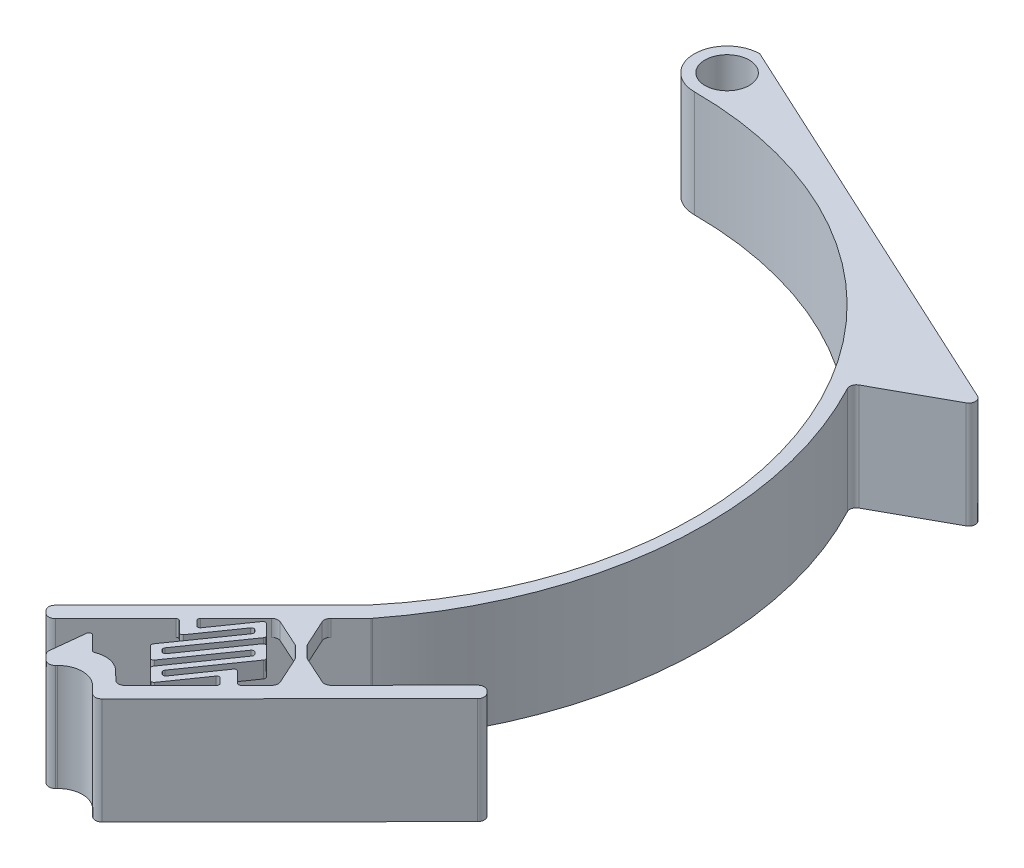
from build123d import *

# Parameters (mm, degrees)
SKETCH1_R           = 2.700000000000001
BOSS_EXTRUDE1_DEPTH = 13
SKETCH2_W           = 10
SKETCH2_H           = 9
CUT_EXTRUDE1_DEPTH  = 23
FILLET2_R           = 0.8
FILLET4_R           = 3
FILLET5_R           = 3
FILLET6_R           = 0.3
CUT_EXTRUDE2_DEPTH  = 77.54524182212118
FILLET7_R           = 0.3


with BuildPart() as part:
    # Sketch1 → Boss-Extrude1 (new body)
    with BuildSketch(Plane(origin=(0, 0, 0), x_dir=(1, 0, 0), z_dir=(0, 1, 0))):
        with BuildLine():
            Line((50.82068164403521, 29.47855622552852), (0, 52.99999999999999))
            ThreePointArc((-9.3e-16, 52.999999999999986), (-4.000000000000001, 48.999999999999986), (0, 44.999999999999986))
            ThreePointArc((0, 44.99999999999999), (40.783850416649216, 19.017821778331506), (34.47199994035405, -28.925442435894198))
            Line((34.47199994035406, -28.925442435894198), (14.701711021792928, -48.75309171856499))
            Line((14.701711021792928, -48.75309171856499), (16.117971684840867, -50.16525521274795))
            Line((16.117971684840867, -50.16525521274795), (24.237911776392924, -42.02175640022227))
            Line((24.237911776392927, -42.02175640022228), (25.457632533795294, -43.23794856854385))
            Line((25.457632533795294, -43.23794856854385), (24.004584374330847, -45.319527553848765))
            Line((24.004584374330847, -45.319527553848765), (29.270758591294335, -50.57046700111043))
            Line((29.270758591294335, -50.57046700111043), (32.75807417400898, -45.574677436378636))
            Line((32.758074174008996, -45.57467743637865), (33.79050120645283, -46.604117710803244))
            Line((33.79050120645283, -46.604117710803244), (27.435765482629456, -52.97729069451893))
            Line((27.435765482629456, -52.97729069451893), (23.895113825009613, -49.4468819590615))
            Line((23.895113825009613, -49.4468819590615), (22.48295033082662, -50.86314262210947))
            Line((22.482950330826625, -50.86314262210948), (20.216933269949923, -48.60368103141674))
            Line((20.216933269949923, -48.60368103141674), (19.658623342460707, -53.69566394820534))
            Line((19.658623342460707, -53.69566394820534), (21.07488400550864, -55.107827442388306))
            Line((21.07488400550864, -55.107827442388306), (23.899210993874593, -52.2753061162924))
            Line((23.899210993874593, -52.2753061162924), (27.439862651494487, -55.80571485174985))
            Line((27.439862651494487, -55.80571485174985), (51.446642052604766, -31.729283579934936))
            Line((51.446642052604766, -31.729283579934936), (50.03038138955682, -30.317120085751977))
            Line((50.03038138955682, -30.317120085751977), (40.14523693027602, -40.2309447270876))
            Line((40.14523693027599, -40.230944727087575), (36.25359298354292, -38.4688132360076))
            Line((36.25359298354292, -38.4688132360076), (34.83733232049498, -37.05664974182466))
            Line((34.83733232049498, -37.05664974182466), (33.06393361503627, -33.17012725617283))
            Line((33.06393361503627, -33.170127256172826), (35.888260603401996, -30.33760593007715))
            Line((35.888260603401996, -30.337605930077153), (36.00408882659194, -30.211017655267213))
            ThreePointArc((36.00408882659193, -30.21101765526721), (46.25018879499116, -3.9090121285464847), (40.31112943915416, 23.686379393552322))
            Line((40.311129439154236, 23.68637939355237), (50.82068164403521, 29.47855622552852))
        make_face()
        Polygon((33.62990306968764, -44.32573004519569), (35.082951229152066, -42.24415105989079), (29.816777012188606, -36.993211612629146), (26.329461429473948, -41.9890011773609), (25.297034397030146, -40.95956090293633), (30.239606626670415, -36.002648582268634), (34.1312505734035, -37.764780073348625), (35.54751123645144, -39.17694356753157), (37.32090994191008, -43.063466053183454), (34.84962382709, -45.541922213517246), align=None, mode=Mode.SUBTRACT)
        with Locations(Location((-6.7e-16, 48.999999999999986, 0), (0, 0, 90))):
            Circle(SKETCH1_R, mode=Mode.SUBTRACT)
        Polygon((25.766501941183627, -45.664178563655604), (25.129184642812053, -45.028704991273266), (29.778938753098288, -38.367652238297545), (30.416256051469855, -39.003125810679876), align=None, mode=Mode.SUBTRACT)
        Polygon((32.77765265760389, -41.35769101853747), (28.127898547317656, -48.01874377151319), (27.49058124894608, -47.383270199130855), (32.14033535923231, -40.72221744615515), align=None, mode=Mode.SUBTRACT)
        Polygon((31.596954354536862, -40.18040841460868), (26.947200244250638, -46.84146116758439), (26.309882945879064, -46.205987595202075), (30.959637056165306, -39.544934842226354), align=None, mode=Mode.SUBTRACT)
        Polygon((33.9583509606709, -42.53497362246627), (29.308596850384667, -49.196026375442), (28.671279552013097, -48.560552803059664), (33.32103366229933, -41.89950005008393), align=None, mode=Mode.SUBTRACT)
    extrude(amount=BOSS_EXTRUDE1_DEPTH)

    # Sketch2 → Cut-Extrude1 (cut)
    with BuildSketch(Plane(origin=(-10.692148728522213, 0, 10.72317030573381), x_dir=(0.7081303315239577, 0, 0.7060817470914894), z_dir=(-0.7060817470914894, 0, 0.7081303315239577))):
        with Locations((51.834395676587306, 6.5)):
            Rectangle(SKETCH2_W, SKETCH2_H)
    extrude(amount=-CUT_EXTRUDE1_DEPTH, mode=Mode.SUBTRACT)

    # Fillet2
    fillet2_edges = [part.edges().sort_by_distance(p)[0] for p in [
        (30.239606626670415, 1, 36.00264858226864),
        (37.32090994191008, 1, 43.063466053183454),
        (33.06393361503627, 1, 33.17012725617283),
        (34.83733232049498, 1, 37.05664974182466),
        (36.25359298354292, 1, 38.4688132360076),
        (40.145236930276006, 1, 40.23094472708759),
        (14.701711021792928, 6.5, 48.75309171856499),
        (16.117971684840867, 6.5, 50.16525521274795),
        (30.239606626670415, 12, 36.00264858226864),
        (34.1312505734035, 12, 37.764780073348625),
        (35.54751123645144, 12, 39.17694356753157),
        (37.32090994191008, 12, 43.063466053183454),
        (27.435765482629456, 6.5, 52.97729069451893),
        (19.658623342460707, 6.5, 53.69566394820534),
        (21.07488400550864, 6.5, 55.107827442388306),
        (27.439862651494487, 6.5, 55.80571485174985),
        (51.446642052604766, 6.5, 31.729283579934936),
        (50.03038138955682, 6.5, 30.317120085751977),
        (40.145236930276006, 12, 40.23094472708759),
        (36.25359298354292, 12, 38.4688132360076),
        (34.83733232049498, 12, 37.05664974182466),
        (33.06393361503627, 12, 33.17012725617283),
        (40.3111294391542, 6.5, -23.686379393552343),
        (50.82068164403521, 6.5, -29.47855622552852),
    ]]
    fillet(fillet2_edges, radius=FILLET2_R)

    # Fillet4
    fillet4_edges = [part.edges().sort_by_distance(p)[0] for p in [
        (23.899210993874593, 6.5, 52.2753061162924),
    ]]
    fillet(fillet4_edges, radius=FILLET4_R)

    # Fillet5
    # the kernel refuses this fillet: 3 mm, written as the material it takes off along each edge
    with BuildSketch(Plane(origin=(23.895113825009613, -7.071067811865554, 49.4468819590615), x_dir=(-0.7060817470914765, 0, 0.7081303315239703), z_dir=(0, 1, 0))) as fillet5_piece_1:
        with BuildLine():
            CenterArc((3.000000000000024, 2.828427124746201), FILLET5_R, 179.99999999999963, 70.52877936551027)
            Line((2.418e-14, 2.828427124746221), (-0.05999999999997915, 2.82842712474622))
            Line((-0.05999999999997915, 2.82842712474622), (-0.06000000000000331, -1.1e-15))
            Line((-0.06000000000000331, -1.1e-15), (-1.41e-15, -0.0600000000000008))
            ThreePointArc((-1.41e-15, -0.0600000000000008), (1.0000000000000304, -0.06000000000000592), (1.980000000000056, -0.05656854249492344))
            Line((1.980000000000056, -0.05656854249492344), (2.0000000000000537, -1e-16))
        make_face()
    extrude(amount=27.142135623731107, mode=Mode.SUBTRACT)

    # Fillet6
    fillet6_edges = [part.edges().sort_by_distance(p)[0] for p in [
        (22.482950330826622, 6.5, 50.86314262210948),
        (20.216933269949923, 6.5, 48.60368103141674),
    ]]
    fillet(fillet6_edges, radius=FILLET6_R)

    # Sketch3 → Cut-Extrude2 (cut, through all)
    with BuildSketch(Plane(origin=(0, 13, 0), x_dir=(1, 0, 0), z_dir=(0, 1, 0))):
        Polygon((25.185282677397836, -46.49681015777757), (26.638330836862288, -44.41523117247264), (25.457632533795273, -43.237948568543835), (24.004584374330815, -45.319527553848765), align=None)
        Polygon((26.909361985160295, -48.21590179325282), (27.546679283531883, -48.851375365635164), (28.127898547317642, -48.0187437715132), (27.490581248946064, -47.38327019913086), align=None)
        Polygon((33.90225292608507, -41.06686845596201), (32.44920476662062, -43.14844744126692), (33.62990306968764, -44.325730045195726), (35.082951229152094, -42.2441510598908), align=None)
        Polygon((32.178173618322624, -39.34777682048674), (31.540856319951057, -38.71230324810441), (30.959637056165292, -39.54493484222635), (31.596954354536862, -40.18040841460868), align=None)
    extrude(amount=-CUT_EXTRUDE2_DEPTH, mode=Mode.SUBTRACT)

    # Fillet7
    fillet7_edges = [part.edges().sort_by_distance(p)[0] for p in [
        (25.297034397030146, 1, 40.95956090293633),
        (26.32946142947395, 1, 41.989001177360905),
        (24.237911776392927, 1, 42.02175640022227),
        (33.79050120645283, 1, 46.604117710803244),
        (32.75807417400899, 12, 45.57467743637864),
        (34.84962382709002, 1, 45.54192221351727),
        (30.416256051469855, 1, 39.003125810679876),
        (29.778938753098288, 1, 38.367652238297545),
        (26.309882945879064, 1, 46.205987595202075),
        (26.947200244250638, 1, 46.84146116758439),
        (32.77765265760389, 1, 41.35769101853747),
        (32.14033535923231, 1, 40.72221744615515),
        (28.671279552013097, 1, 48.560552803059664),
        (29.308596850384667, 1, 49.196026375442),
        (29.270758591294335, 1, 50.57046700111043),
        (29.816777012188606, 1, 36.993211612629146),
        (29.270758591294335, 12, 50.57046700111043),
        (29.816777012188606, 12, 36.993211612629146),
        (29.308596850384667, 12, 49.196026375442),
        (28.671279552013097, 12, 48.560552803059664),
        (32.14033535923231, 12, 40.72221744615515),
        (32.77765265760389, 12, 41.35769101853747),
        (26.309882945879064, 12, 46.205987595202075),
        (26.947200244250638, 12, 46.84146116758439),
        (29.778938753098288, 12, 38.367652238297545),
        (30.416256051469855, 12, 39.003125810679876),
        (25.185282677397836, 12, 46.49681015777757),
        (25.185282677397836, 1, 46.49681015777757),
        (26.001013538490724, 12, 43.77975760009032),
        (26.001013538490724, 1, 43.77975760009032),
        (27.546679283531883, 12, 48.851375365635164),
        (27.546679283531883, 1, 48.851375365635164),
        (26.909361985160295, 12, 48.21590179325282),
        (26.909361985160295, 1, 48.21590179325282),
        (33.90225292608507, 12, 41.06686845596201),
        (33.90225292608507, 1, 41.06686845596201),
        (33.086522064992195, 12, 43.783921013649255),
        (33.086522064992195, 1, 43.783921013649255),
        (31.540856319951057, 12, 38.71230324810441),
        (31.540856319951057, 1, 38.71230324810441),
        (32.178173618322624, 12, 39.34777682048674),
        (32.178173618322624, 1, 39.34777682048674),
        (26.32946142947395, 12, 41.989001177360905),
        (32.75807417400899, 1, 45.57467743637864),
        (25.297034397030146, 12, 40.95956090293633),
        (24.237911776392927, 12, 42.02175640022227),
        (33.79050120645283, 12, 46.604117710803244),
        (34.84962382709002, 12, 45.54192221351727),
    ]]
    fillet(fillet7_edges, radius=FILLET7_R)


solid = part.part
